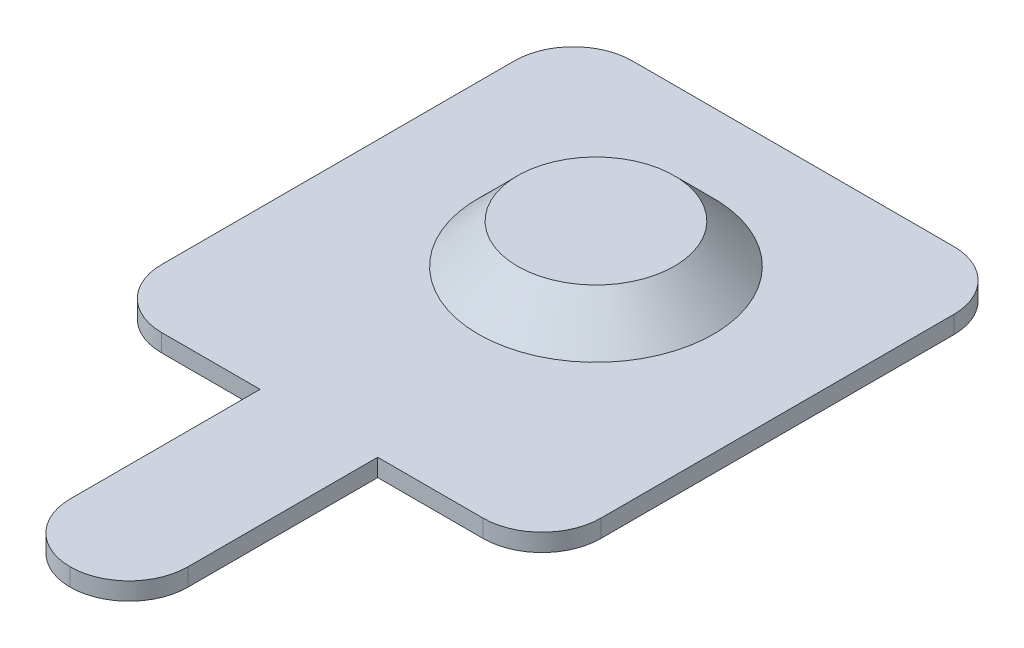
from build123d import *

# Parameters (mm, degrees)
SKETCH1_W           = 11.2
SKETCH1_H           = 12
SKETCH1_W_2         = 3
SKETCH1_H_2         = 6.34
BOSS_EXTRUDE1_DEPTH = 0.45
FILLET1_R           = 1.5
SKETCH2_R           = 2
BOSS_EXTRUDE2_DEPTH = 1
CHAMFER1_SIZE       = 1


with BuildPart() as part:
    # Sketch1 → Boss-Extrude1 (new body)
    with BuildSketch(Plane(origin=(0, 0, 0), x_dir=(1, 0, 0), z_dir=(0, 1, 0))):
        with Locations((5.6, 6)):
            Rectangle(SKETCH1_W, SKETCH1_H)
        with Locations((5.509745164, -3.17)):
            Rectangle(SKETCH1_W_2, SKETCH1_H_2)
    extrude(amount=BOSS_EXTRUDE1_DEPTH)

    # Fillet1
    fillet1_edges = [part.edges().sort_by_distance(p)[0] for p in [
        (0, 0.225, 0),
        (0, 0.225, -12),
        (11.2, 0.225, -12),
        (11.2, 0.225, 0),
        (7.009745164, 0.225, 6.34),
        (4.009745164, 0.225, 6.34),
    ]]
    fillet(fillet1_edges, radius=FILLET1_R - 0.0001)  # a hair under: the kernel refuses the full size

    # Sketch2 → Boss-Extrude2 (add)
    with BuildSketch(Plane(origin=(0, 0.45, 0), x_dir=(1, 0, 0), z_dir=(0, 1, 0))):
        with Locations(Location((5.575393992, 7, 0), (0, 0, 270))):
            Circle(SKETCH2_R)
    extrude(amount=BOSS_EXTRUDE2_DEPTH)

    # Chamfer1
    chamfer1_edges = [part.edges().sort_by_distance(p)[0] for p in [
        (5.575393992, 0.45, -9),
    ]]
    chamfer(chamfer1_edges, length=CHAMFER1_SIZE - 0.0001)  # a hair under: the kernel refuses the full size


solid = part.part
